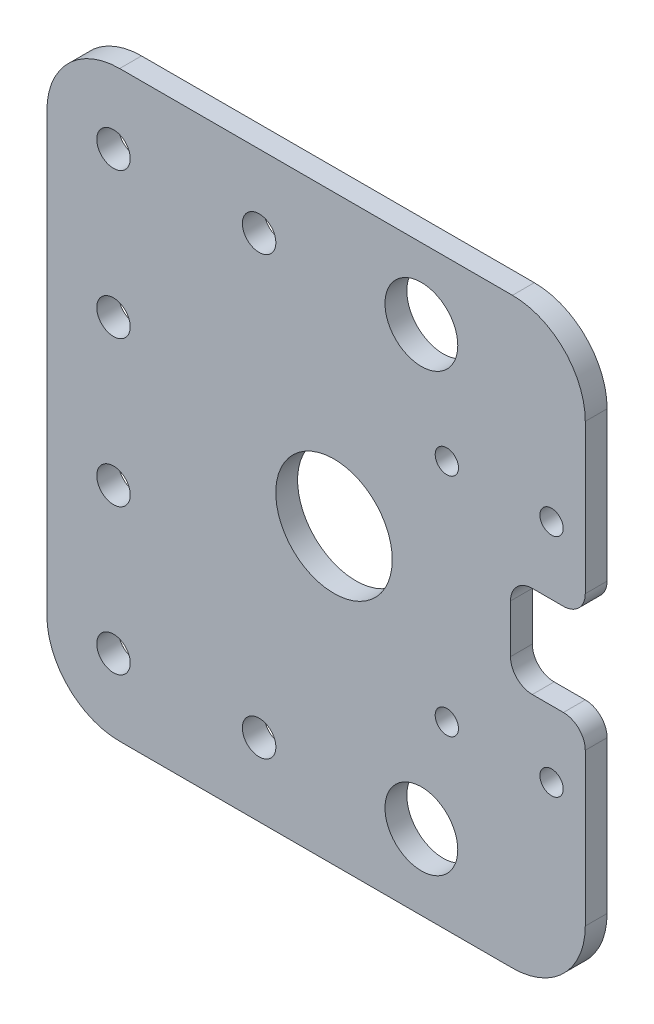
from build123d import *

# Parameters (mm, degrees)
SKETCH1_R           = 2.3
SKETCH1_R_2         = 1.6
SKETCH1_R_3         = 8
SKETCH1_R_4         = 5
BOSS_EXTRUDE1_DEPTH = 3
FILLET1_R           = 3


with BuildPart() as part:
    # Sketch1 → Boss-Extrude1 (new body)
    with BuildSketch(Plane.XY):
        with BuildLine():
            Line((157.960700719, -71.866196008), (170.473892307, -71.866196008))
            ThreePointArc((170.473892307, -71.866196008), (177.544960119, -74.795128196), (180.473892307, -81.866196008))
            Line((180.473892307, -81.866196008), (180.473892307, -102.365535019))
            Line((180.473892307, -102.365535019), (180.473892307, -105.365535019))
            Line((180.473892307, -105.365535019), (170.198907285, -105.365535019))
            Line((170.198907285, -105.365535019), (170.198907285, -117.989469864))
            Line((170.198907285, -117.989469864), (180.473892307, -117.989469864))
            Line((180.473892307, -117.989469864), (180.473892307, -120.989469864))
            Line((180.473892307, -120.989469864), (180.473892307, -141.896756479))
            ThreePointArc((180.473892307, -141.896756479), (177.544960119, -148.967824291), (170.473892307, -151.896756479))
            Line((170.473892307, -151.896756479), (157.960700719, -151.896756479))
            Line((157.960700719, -151.896756479), (116.525823666, -151.896756479))
            ThreePointArc((116.525823666, -151.896756479), (109.454755854, -148.967824291), (106.525823666, -141.896756479))
            Line((106.525823666, -141.896756479), (106.525823666, -81.866196008))
            ThreePointArc((106.525823666, -81.866196008), (109.454755854, -74.795128196), (116.525823666, -71.866196008))
            Line((116.525823666, -71.866196008), (157.960700719, -71.866196008))
        make_face()
        with Locations((115.674612816, -101.866196008)):
            Circle(SKETCH1_R, mode=Mode.SUBTRACT)
        with Locations((115.674612816, -121.866196008)):
            Circle(SKETCH1_R, mode=Mode.SUBTRACT)
        with Locations((135.674612816, -141.866196008)):
            Circle(SKETCH1_R, mode=Mode.SUBTRACT)
        with Locations((135.674612816, -81.866196008)):
            Circle(SKETCH1_R, mode=Mode.SUBTRACT)
        with Locations((115.674612816, -81.866196008)):
            Circle(SKETCH1_R, mode=Mode.SUBTRACT)
        with Locations((115.674612816, -141.866196008)):
            Circle(SKETCH1_R, mode=Mode.SUBTRACT)
        with Locations((161.460700719, -96.114221831)):
            Circle(SKETCH1_R_2, mode=Mode.SUBTRACT)
        with Locations((161.460700719, -127.114221831)):
            Circle(SKETCH1_R_2, mode=Mode.SUBTRACT)
        with Locations((145.960700719, -111.591712302)):
            Circle(SKETCH1_R_3, mode=Mode.SUBTRACT)
        with Locations((175.843347401, -96.114221831)):
            Circle(SKETCH1_R_2, mode=Mode.SUBTRACT)
        with Locations((157.960700719, -81.591712302)):
            Circle(SKETCH1_R_4, mode=Mode.SUBTRACT)
        with Locations((157.960700719, -141.591712302)):
            Circle(SKETCH1_R_4, mode=Mode.SUBTRACT)
        with Locations((175.843347401, -127.114221831)):
            Circle(SKETCH1_R_2, mode=Mode.SUBTRACT)
    extrude(amount=BOSS_EXTRUDE1_DEPTH)

    # Fillet1
    fillet1_edges = [part.edges().sort_by_distance(p)[0] for p in [
        (170.198907285, -117.989469864, 1.5),
        (180.473892307, -117.989469864, 1.5),
        (170.198907285, -105.365535019, 1.5),
        (180.473892307, -105.365535019, 1.5),
    ]]
    fillet(fillet1_edges, radius=FILLET1_R)


solid = part.part
